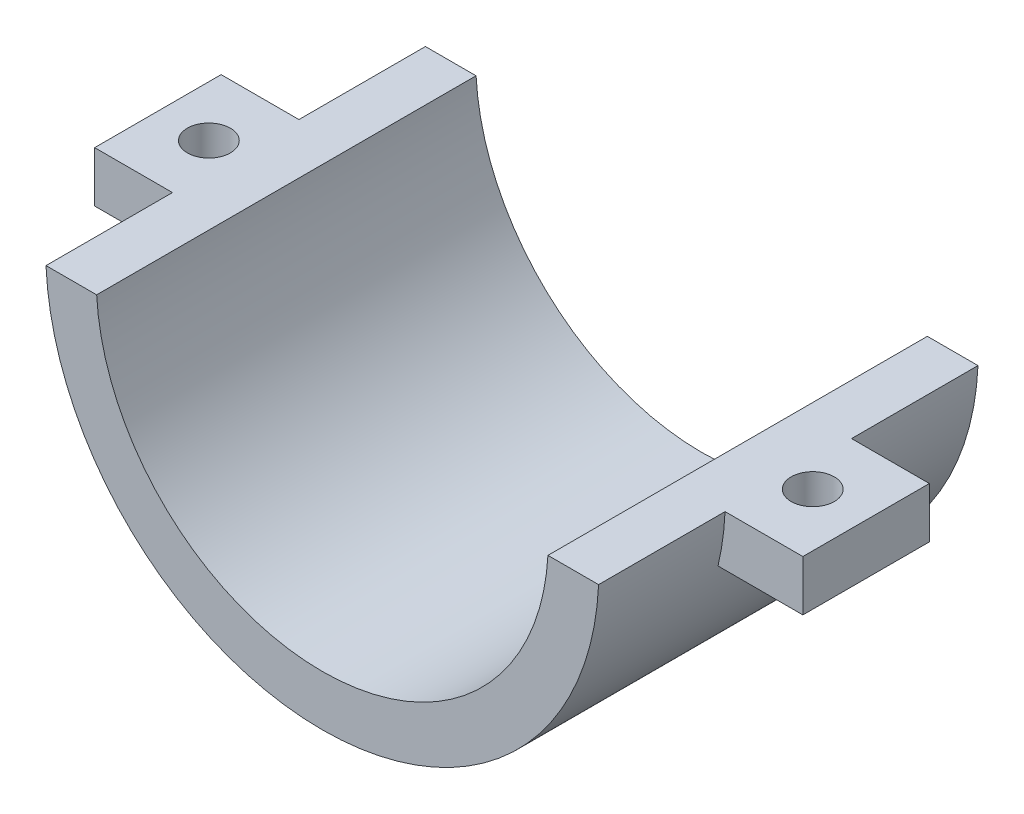
from build123d import *

# Parameters (mm, degrees)
SKETCH1_W                = 4
SKETCH1_H                = 30
REVOLVE1_ANGLE           = 180
BOSS_EXTRUDE3_DEPTH      = 5
BOSS_EXTRUDE3_DEPTH_BACK = 5
SKETCH6_W                = 8.13
SKETCH6_H                = 5
M3_CLEARANCE_HOLE1_D     = 3.4
M3_CLEARANCE_HOLE1_DEPTH = 8.87
M3_CLEARANCE_HOLE1_TIP   = 1.021463052
SKETCH11_W               = 62.08504313
SKETCH11_H               = 41.873291452
CUT_EXTRUDE1_DEPTH       = 1


with BuildPart() as part:
    # Sketch1 → Revolve1 (revolve)
    with BuildSketch(Plane(origin=(0, 0, 0), x_dir=(1, 0, 0), z_dir=(0, 1, 0))):
        with Locations((-19.87, 0)):
            Rectangle(SKETCH1_W, SKETCH1_H)
    revolve(axis=Axis((0, 0, -19.621046531), (0, 0, 1)), revolution_arc=REVOLVE1_ANGLE)

    # Sketch6 → Boss-Extrude3 (add, two sides: drawn at the far end of the back side and taken through both)
    with BuildSketch(Plane.XY.offset(-BOSS_EXTRUDE3_DEPTH_BACK)):
        with Locations((-23.935, -2.5)):
            Rectangle(SKETCH6_W, SKETCH6_H)
        with Locations((23.935, -2.5)):
            Rectangle(SKETCH6_W, SKETCH6_H)
    extrude(amount=BOSS_EXTRUDE3_DEPTH + BOSS_EXTRUDE3_DEPTH_BACK)

    # M3 Clearance Hole1
    with Locations(Plane(origin=(0, 0, 0), x_dir=(1, 0, 0), z_dir=(0, 1, 0))):
        with Locations((-23.970037453, 0), (23.778277154, 0)):
            Hole(M3_CLEARANCE_HOLE1_D / 2, depth=M3_CLEARANCE_HOLE1_DEPTH)
            with Locations((0, 0, -(M3_CLEARANCE_HOLE1_DEPTH + M3_CLEARANCE_HOLE1_TIP / 2))):  # 118° drill point
                Cone(0, M3_CLEARANCE_HOLE1_D / 2, M3_CLEARANCE_HOLE1_TIP, mode=Mode.SUBTRACT)

    # Sketch11 → Cut-Extrude1 (cut)
    with BuildSketch(Plane(origin=(0, 0, 0), x_dir=(1, 0, 0), z_dir=(0, 1, 0))):
        Rectangle(SKETCH11_W, SKETCH11_H)
    extrude(amount=-CUT_EXTRUDE1_DEPTH, mode=Mode.SUBTRACT)


solid = part.part
